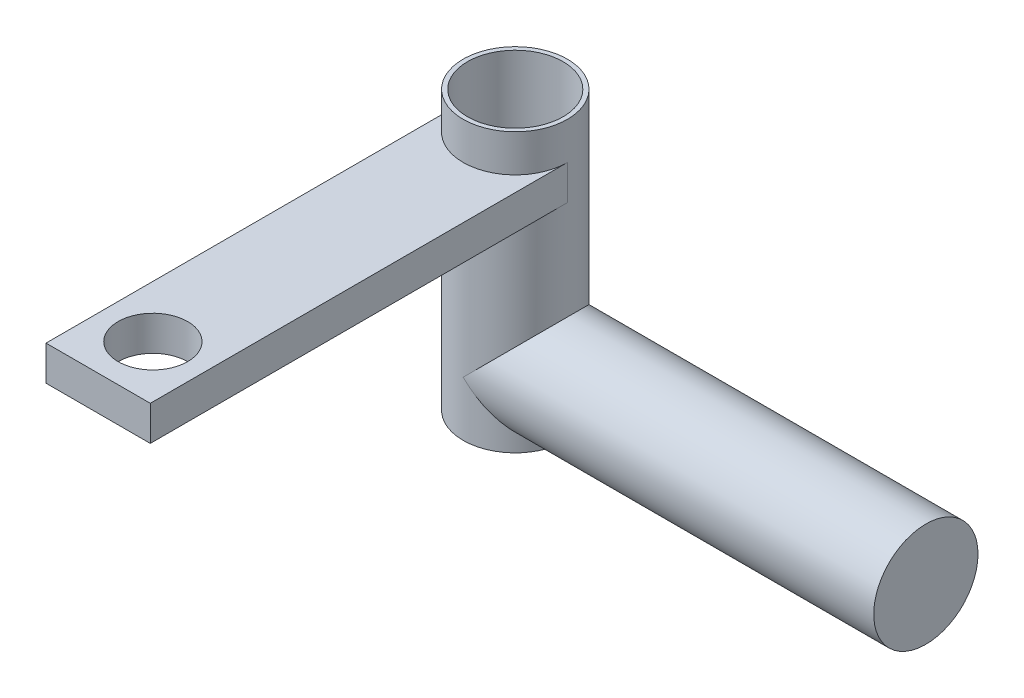
from build123d import *

# Parameters (mm, degrees)
SKETCH1_R          = 9.525
SLEEVE_DEPTH       = 50.8
SKETCH2_W          = 19.05
SKETCH2_H          = 6.35
BRACKET_DEPTH      = 76.2
SKETCH4_R          = 6.35
BRACKET_HOLE_DEPTH = 93.075
SKETCH5_R          = 9.525
SHAFT_DEPTH        = 75
SKETCH6_R          = 8.73125
SLEEVE_HOLE_DEPTH  = 119.372631972


with BuildPart() as part:
    # Sketch1 → Sleeve (new body)
    with BuildSketch(Plane(origin=(0, 0, 0), x_dir=(1, 0, 0), z_dir=(0, 1, 0))):
        Circle(SKETCH1_R)
    extrude(amount=SLEEVE_DEPTH)

    # Sketch2 → Bracket (add)
    with BuildSketch(Plane.XY):
        with Locations((0, 40.8)):
            Rectangle(SKETCH2_W, SKETCH2_H)
    extrude(amount=BRACKET_DEPTH)

    # Sketch4 → Bracket Hole (cut, through all)
    with BuildSketch(Plane(origin=(0, 0, 0), x_dir=(1, 0, 0), z_dir=(0, 1, 0))):
        with Locations((0, -66.2)):
            Circle(SKETCH4_R)
    extrude(amount=BRACKET_HOLE_DEPTH, mode=Mode.SUBTRACT)

    # Sketch5 → Shaft (add)
    with BuildSketch(Plane(origin=(0, 0, 0), x_dir=(0, 0, -1), z_dir=(1, 0, 0))):
        with Locations((0, 10)):
            Circle(SKETCH5_R)
    extrude(amount=SHAFT_DEPTH)

    # Sketch6 → Sleeve Hole (cut, through all)
    with BuildSketch(Plane(origin=(0, 0, 0), x_dir=(1, 0, 0), z_dir=(0, 1, 0))):
        Circle(SKETCH6_R)
    extrude(amount=SLEEVE_HOLE_DEPTH, mode=Mode.SUBTRACT)


solid = part.part
